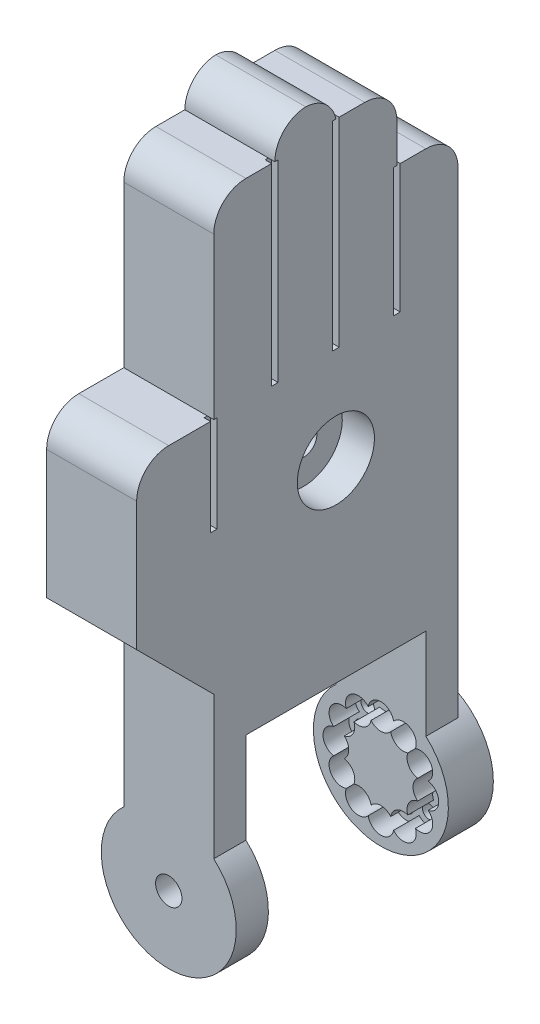
from build123d import *

# Parameters (mm, degrees)
SKETCH2_R               = 10.5
BOSS_EXTRUDE1_DEPTH     = 40
SKETCH4_W               = 14
SKETCH4_H               = 22
BOSS_EXTRUDE2_DEPTH     = 38
CUT_EXTRUDE1_DEPTH      = 49.890183064
CUT_EXTRUDE1_DEPTH_BACK = 49.890183064
SKETCH5_W               = 28
SKETCH5_H               = 32.5
SKETCH6_W               = 14
SKETCH6_H               = 38
BOSS_EXTRUDE3_DEPTH     = 40
SKETCH7_W               = 9.5
SKETCH7_H               = 25
BOSS_EXTRUDE4_DEPTH     = 14
BOSS_EXTRUDE5_DEPTH     = 14
SKETCH9_W               = 1
SKETCH9_H               = 30
SKETCH9_H_2             = 31
SKETCH9_H_3             = 20
SKETCH9_H_4             = 15
CUT_EXTRUDE2_DEPTH      = 1
FILLET1_R               = 5
SKETCH10_R              = 12.5
CUT_EXTRUDE3_DEPTH      = 6
SKETCH11_R              = 2.05
CUT_EXTRUDE4_DEPTH      = 116.062756142
SKETCH12_R              = 6
CUT_EXTRUDE5_DEPTH      = 5
CUT_EXTRUDE6_REACH      = 112.061
SKETCH13_R              = 2.05
SKETCH14_R              = 4.5
CUT_EXTRUDE7_DEPTH      = 2
SKETCH15_R              = 1.05
CUT_EXTRUDE8_DEPTH      = 112.975166224
SKETCH17_R              = 2
CUT_EXTRUDE9_DEPTH      = 4


with BuildPart() as part:
    # Sketch2 → Boss-Extrude1 (new body)
    with BuildSketch(Plane.XY):
        Circle(SKETCH2_R)
    extrude(amount=BOSS_EXTRUDE1_DEPTH)

    # Sketch4 → Boss-Extrude2 (add)
    with BuildSketch(Plane.XY.offset(40)):
        with Locations((0, 11)):
            Rectangle(SKETCH4_W, SKETCH4_H)
    extrude(amount=-BOSS_EXTRUDE2_DEPTH)

    # Sketch5 → Cut-Extrude1 (cut, two sides: drawn at the far end of the back side and taken through both)
    with BuildSketch(Plane(origin=(7, 0, 0), x_dir=(0, 0, -1), z_dir=(1, 0, 0)).offset(-CUT_EXTRUDE1_DEPTH_BACK)):
        with Locations((-21, 5.75)):
            Rectangle(SKETCH5_W, SKETCH5_H)
    extrude(amount=CUT_EXTRUDE1_DEPTH + CUT_EXTRUDE1_DEPTH_BACK, mode=Mode.SUBTRACT)


with BuildPart() as cut_extrude1_piece_1:
    # of the separate pieces the step leaves, piece 1, a body of its own (cut_extrude1_pieces)
    add(part.part.solids().sort_by_distance((10.5, 0, 0))[0])



with BuildPart() as cut_extrude1_piece_2:
    # of the separate pieces the step leaves, piece 2, a body of its own (cut_extrude1_pieces)
    add(part.part.solids().sort_by_distance((7, 7.826237921, 40))[0])


with BuildPart() as cut_extrude1_piece_1_1:
    add(cut_extrude1_piece_1.part)

    add(cut_extrude1_piece_2.part)  # Boss-Extrude3 merges Cut-Extrude1 piece 2
    # Sketch6 → Boss-Extrude3 (add)
    with BuildSketch(Plane(origin=(0, 22, 0), x_dir=(1, 0, 0), z_dir=(0, 1, 0))):
        with Locations((0, -21)):
            Rectangle(SKETCH6_W, SKETCH6_H)
    extrude(amount=BOSS_EXTRUDE3_DEPTH)

    # Sketch7 → Boss-Extrude4 (add)
    with BuildSketch(Plane(origin=(7, 0, 0), x_dir=(0, 0, -1), z_dir=(1, 0, 0))):
        Polygon((-52, 42), (-40, 42), (-40, 62), (-40, 67), (-52, 67), align=None)
        Polygon((-40, 67), (-40, 62), (-30.5, 62), (-30.5, 97), (-40, 97), align=None)
        Polygon((-30.5, 97), (-30.5, 62), (-21, 62), (-21, 98), (-21, 102), (-30.5, 102), align=None)
        Polygon((-21, 98), (-21, 62), (-11.5, 62), (-11.5, 87), (-11.5, 98), align=None)
        with Locations((-6.75, 74.5)):
            Rectangle(SKETCH7_W, SKETCH7_H)
    extrude(amount=-BOSS_EXTRUDE4_DEPTH)

    # Sketch8 → Boss-Extrude5 (add)
    with BuildSketch(Plane(origin=(7, 0, 0), x_dir=(0, 0, -1), z_dir=(1, 0, 0))):
        Polygon((-52, 42), (-40, 30), (-40, 42), align=None)
    extrude(amount=-BOSS_EXTRUDE5_DEPTH)

    # Sketch9 → Cut-Extrude2 (cut)
    with BuildSketch(Plane(origin=(7, 0, 0), x_dir=(0, 0, -1), z_dir=(1, 0, 0))):
        with Locations((-30.5, 82)):
            Rectangle(SKETCH9_W, SKETCH9_H)
        with Locations((-21, 82.5)):
            Rectangle(SKETCH9_W, SKETCH9_H_2)
        with Locations((-11.5, 77)):
            Rectangle(SKETCH9_W, SKETCH9_H_3)
        with Locations((-40, 59.5)):
            Rectangle(SKETCH9_W, SKETCH9_H_4)
    extrude(amount=-CUT_EXTRUDE2_DEPTH, mode=Mode.SUBTRACT)

    # Fillet1
    # the kernel refuses this fillet: 5 mm, written as the material it takes off along each edge
    with BuildSketch(Plane(origin=(19.5, 67, 52), x_dir=(0, -1, 0), z_dir=(-1, 0, 0)), Plane(origin=(19.5, 97, 40), x_dir=(0, -1, 0), z_dir=(-1, 0, 0)), Plane(origin=(19.5, 102, 30.5), x_dir=(0, -1, 0), z_dir=(-1, 0, 0)), Plane(origin=(19.5, 98, 11.5), x_dir=(0, 0, 1), z_dir=(-1, 0, 0)), Plane(origin=(19.5, 87, 2), x_dir=(0, 0, 1), z_dir=(-1, 0, 0))) as fillet1_piece_1:
        with BuildLine():
            CenterArc((FILLET1_R, -FILLET1_R), FILLET1_R, 90, 90)
            Line((0, -FILLET1_R), (-FILLET1_R * 0.02, -FILLET1_R))
            Line((-FILLET1_R * 0.02, -FILLET1_R), (-FILLET1_R * 0.02, FILLET1_R * 0.02))
            Line((-FILLET1_R * 0.02, FILLET1_R * 0.02), (FILLET1_R, FILLET1_R * 0.02))
            Line((FILLET1_R, FILLET1_R * 0.02), (FILLET1_R, 0))
        make_face()
    extrude(amount=39, mode=Mode.SUBTRACT)
    with BuildSketch(Plane(origin=(19.247448714, 102, 21), x_dir=(0, 0, 1), z_dir=(-1, 0, 0))) as fillet1_piece_2:
        with BuildLine():
            CenterArc((4.898979486, -5), FILLET1_R, 90, 78.463040967)
            Line((0, -4), (-0.09797959, -3.98))
            ThreePointArc((-0.09797959, -3.98), (-0.1, -2), (-0.1, 0))
            Line((-0.1, 0), (0, 0.1))
            Line((0, 0.1), (4.898979486, 0.1))
            Line((4.898979486, 0.1), (4.898979486, 0))
        make_face()
    extrude(amount=38.494897428, mode=Mode.SUBTRACT)

    # Sketch10 → Cut-Extrude3 (cut)
    with BuildSketch(Plane.ZY.offset(7)):
        with Locations((21, 52)):
            Circle(SKETCH10_R)
    extrude(amount=-CUT_EXTRUDE3_DEPTH, mode=Mode.SUBTRACT)

    # Sketch11 → Cut-Extrude4 (cut, through all)
    with BuildSketch(Plane.ZY.offset(1)):
        with Locations((21, 52)):
            Circle(SKETCH11_R)
    extrude(amount=-CUT_EXTRUDE4_DEPTH, mode=Mode.SUBTRACT)

    # Sketch12 → Cut-Extrude5 (cut)
    with BuildSketch(Plane(origin=(7, 0, 0), x_dir=(0, 0, -1), z_dir=(1, 0, 0))):
        with Locations(Location((-21, 52, 0), (0, 0, 90))):
            Circle(SKETCH12_R)
    extrude(amount=-CUT_EXTRUDE5_DEPTH, mode=Mode.SUBTRACT)

    # Sketch13 → Cut-Extrude6 (cut, up to next)
    with BuildSketch(Plane.XY.offset(40), mode=Mode.PRIVATE) as cut_extrude6_sk1:
        Circle(SKETCH13_R)
    cut_extrude6_tool1 = extrude(cut_extrude6_sk1.sketch, amount=-CUT_EXTRUDE6_REACH, mode=Mode.PRIVATE) & cut_extrude1_piece_1_1.part
    add(cut_extrude6_tool1.solids().sort_by_distance((0, 0, 40))[0], mode=Mode.SUBTRACT)

    # Sketch14 → Cut-Extrude7 (cut)
    with BuildSketch(Plane(origin=(0, 0, 35), x_dir=(-1, 0, 0), z_dir=(0, 0, -1))):
        with Locations(Location((0, 0, 0), (0, 0, 90))):
            Circle(SKETCH14_R)
    extrude(amount=-CUT_EXTRUDE7_DEPTH, mode=Mode.SUBTRACT)

    # Sketch15 → Cut-Extrude8 (cut, through all)
    with BuildSketch(Plane.XY.offset(7)):
        with Locations((-6.062177826, 3.5)):
            Circle(SKETCH15_R)
        with Locations((-6.062177826, -3.5)):
            Circle(SKETCH15_R)
        with Locations((-3.5, -6.062177826)):
            Circle(SKETCH15_R)
        with Locations((0, -7)):
            Circle(SKETCH15_R)
        with Locations((3.5, -6.062177826)):
            Circle(SKETCH15_R)
        with Locations((6.062177826, -3.5)):
            Circle(SKETCH15_R)
        with Locations((7, 0)):
            Circle(SKETCH15_R)
        with Locations((6.062177826, 3.5)):
            Circle(SKETCH15_R)
        with Locations((3.5, 6.062177826)):
            Circle(SKETCH15_R)
        with Locations((0, 7)):
            Circle(SKETCH15_R)
        with Locations((-3.5, 6.062177826)):
            Circle(SKETCH15_R)
        with Locations((-7, 0)):
            Circle(SKETCH15_R)
    extrude(amount=-CUT_EXTRUDE8_DEPTH, mode=Mode.SUBTRACT)

    # Sketch17 → Cut-Extrude9 (cut)
    with BuildSketch(Plane.XY.offset(7)):
        with Locations((0, 7)):
            Circle(SKETCH17_R)
        with Locations((3.5, 6.062177826)):
            Circle(SKETCH17_R)
        with Locations((-3.5, 6.062177826)):
            Circle(SKETCH17_R)
        with Locations((-6.062177826, 3.5)):
            Circle(SKETCH17_R)
        with Locations((-7, 0)):
            Circle(SKETCH17_R)
        with Locations((-6.062177826, -3.5)):
            Circle(SKETCH17_R)
        with Locations((-3.5, -6.062177826)):
            Circle(SKETCH17_R)
        with Locations((0, -7)):
            Circle(SKETCH17_R)
        with Locations((3.5, -6.062177826)):
            Circle(SKETCH17_R)
        with Locations((6.062177826, -3.5)):
            Circle(SKETCH17_R)
        with Locations((7, 0)):
            Circle(SKETCH17_R)
        with Locations((6.062177826, 3.5)):
            Circle(SKETCH17_R)
    extrude(amount=-CUT_EXTRUDE9_DEPTH, mode=Mode.SUBTRACT)


solid = cut_extrude1_piece_1_1.part
